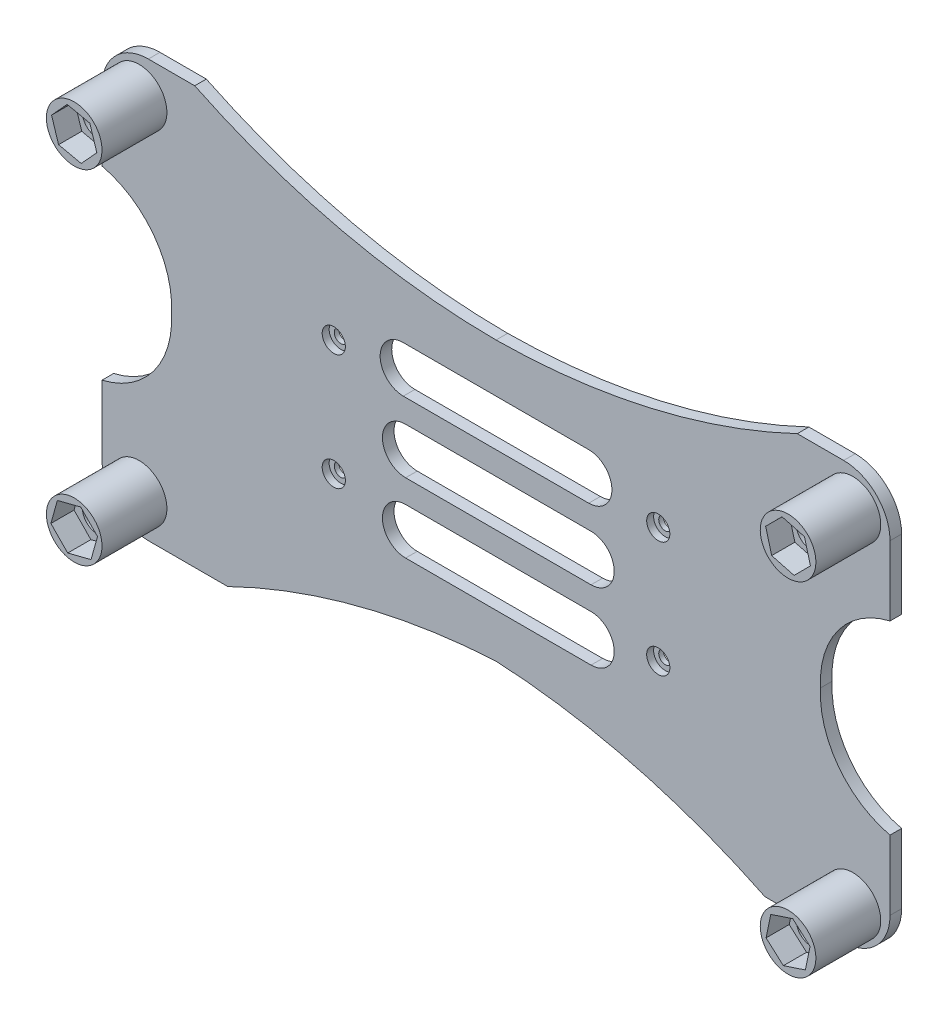
from build123d import *

# Parameters (mm, degrees)
EXTRUDE_1_DEPTH          = 2.5
CUT_EXTRUDE_1_DEPTH      = 42
CUT_EXTRUDE_1_DEPTH_BACK = 10
SKETCH_2_R               = 1.4
SKETCH_3_R               = 2.5
CUT_EXTRUDE_2_DEPTH      = 1.5
SKETCH_7_R               = 6
EXTRUDE_4_DEPTH          = 14
BUTTON_LEFT_NUT_DEPTH    = 5
UP_LEFT_NUT_DEPTH        = 5
UP_RIGHT_NUT_DEPTH       = 5
BUTTON_RIGHT_NUT_DEPTH   = 5
SKETCH_13_R              = 3.25
CUT_EXTRUDE_7_DEPTH      = 13
SKETCH_15_R              = 3.25
CUT_EXTRUDE_8_DEPTH      = 13
SKETCH_16_R              = 3.25
CUT_EXTRUDE_9_DEPTH      = 13
SKETCH_17_R              = 3.25
CUT_EXTRUDE_10_DEPTH     = 13


with BuildPart() as part:
    # 草图1 → 凸台-拉伸1 (new body)
    with BuildSketch(Plane.XY):
        with BuildLine():
            Line((-72.574116531, 45.487390308), (77.425883469, 45.487390308))
            ThreePointArc((77.425883469, 45.487390308), (84.496951281, 42.558458119), (87.425883469, 35.487390308))
            Line((87.425883469, 35.487390308), (87.425883469, -34.512609692))
            ThreePointArc((87.425883469, -34.512609692), (84.496951281, -41.583677504), (77.425883469, -44.512609692))
            Line((77.425883469, -44.512609692), (-72.574116531, -44.512609692))
            ThreePointArc((-72.574116531, -44.512609692), (-79.645184343, -41.583677504), (-82.574116531, -34.512609692))
            Line((-82.574116531, -34.512609692), (-82.574116531, 35.487390308))
            ThreePointArc((-82.574116531, 35.487390308), (-79.645184343, 42.558458119), (-72.574116531, 45.487390308))
        make_face()
    extrude(amount=EXTRUDE_1_DEPTH)

    # 草图2 → 切除-拉伸1 (cut, two sides: drawn at the far end of the back side and taken through both)
    with BuildSketch(Plane.XY.offset(2.5).offset(-CUT_EXTRUDE_1_DEPTH_BACK)):
        with Locations((-32.574116531, 12.987390308)):
            Circle(SKETCH_2_R)
        with Locations((-32.574116531, -12.012609692)):
            Circle(SKETCH_2_R)
        with Locations((37.425883469, 12.987390308)):
            Circle(SKETCH_2_R)
        with Locations((37.425883469, -12.012609692)):
            Circle(SKETCH_2_R)
        with BuildLine():
            Line((-55.457237, -44.512609692), (60.437772164, -44.512609692))
            ThreePointArc((60.437772164, -44.512609692), (32.18844776, -34.086412898), (2.425883469, -29.512609692))
            ThreePointArc((2.425883469, -29.512609692), (-27.27069034, -34.099106912), (-55.457237, -44.512609692))
        make_face()
        with BuildLine():
            Line((-62.574116531, 45.487390308), (67.425883469, 45.487390308))
            ThreePointArc((67.425883469, 45.487390308), (35.747267057, 34.428061428), (2.425883469, 30.487390308))
            ThreePointArc((2.425883469, 30.487390308), (-30.918540876, 34.328218147), (-62.574116531, 45.487390308))
        make_face()
        with BuildLine():
            Line((87.425883469, 20.487390308), (87.425883469, -19.512609692))
            ThreePointArc((87.425883469, -19.512609692), (76.286181126, -12.242386449), (72.425883469, 0.487390308))
            ThreePointArc((72.425883469, 0.487390308), (76.286181126, 13.217167065), (87.425883469, 20.487390308))
        make_face()
        with BuildLine():
            Line((-82.574116531, 20.487390308), (-82.574116531, -19.512609692))
            ThreePointArc((-82.574116531, -19.512609692), (-71.434414188, -12.242386449), (-67.574116531, 0.487390308))
            ThreePointArc((-67.574116531, 0.487390308), (-71.434414188, 13.217167065), (-82.574116531, 20.487390308))
        make_face()
        with BuildLine():
            Line((-17.574116531, 20), (22.425883469, 20))
            ThreePointArc((22.425883469, 20), (27.425883469, 15), (22.425883469, 10))
            Line((22.425883469, 10), (-17.574116531, 10))
            ThreePointArc((-17.574116531, 10), (-22.574116531, 15), (-17.574116531, 20))
        make_face()
        with BuildLine():
            Line((-17.079364826, 5), (22.920635174, 5))
            ThreePointArc((22.920635174, 5), (27.920635174, 0), (22.920635174, -5))
            Line((22.920635174, -5), (-17.079364826, -5))
            ThreePointArc((-17.079364826, -5), (-22.079364826, 0), (-17.079364826, 5))
        make_face()
        with BuildLine():
            Line((-17.079364826, -10), (22.920635174, -10))
            ThreePointArc((22.920635174, -10), (27.920635174, -15), (22.920635174, -20))
            Line((22.920635174, -20), (-17.079364826, -20))
            ThreePointArc((-17.079364826, -20), (-22.079364826, -15), (-17.079364826, -10))
        make_face()
    extrude(amount=CUT_EXTRUDE_1_DEPTH + CUT_EXTRUDE_1_DEPTH_BACK, mode=Mode.SUBTRACT)

    # 草图3 → 切除-拉伸2 (cut)
    with BuildSketch(Plane.XY.offset(2.5)):
        with Locations((-32.574116531, 12.987390308)):
            Circle(SKETCH_3_R)
        with Locations((37.425883469, 12.987390308)):
            Circle(SKETCH_3_R)
        with Locations((37.425883469, -12.012609692)):
            Circle(SKETCH_3_R)
        with Locations((-32.574116531, -12.012609692)):
            Circle(SKETCH_3_R)
    extrude(amount=-CUT_EXTRUDE_2_DEPTH, mode=Mode.SUBTRACT)

    # 草图7 → 凸台-拉伸4 (add)
    with BuildSketch(Plane.XY.offset(2.5)):
        with Locations((-74.574116531, 37.487390308)):
            Circle(SKETCH_7_R)
        with Locations((-74.574116531, -36.512609692)):
            Circle(SKETCH_7_R)
        with Locations((79.425883469, 37.487390308)):
            Circle(SKETCH_7_R)
        with Locations((79.425883469, -36.512609692)):
            Circle(SKETCH_7_R)
    extrude(amount=EXTRUDE_4_DEPTH)

    # 草图9 → button left nut (cut)
    with BuildSketch(Plane.XY.offset(16.5)):
        Polygon((-70.944636645, -40.226166125), (-69.543342379, -35.226166125), (-73.172822265, -31.512609692), (-78.203596417, -32.79905326), (-79.604890683, -37.79905326), (-75.975410797, -41.512609692), align=None)
    extrude(amount=-BUTTON_LEFT_NUT_DEPTH, mode=Mode.SUBTRACT)

    # 草图10 → up left nut (cut)
    with BuildSketch(Plane.XY.offset(16.5)):
        Polygon((-73.060671646, 32.721943363), (-69.690395974, 36.415348553), (-71.203840859, 41.180795498), (-76.087561416, 42.252837252), (-79.457837088, 38.559432062), (-77.944392202, 33.793985117), align=None)
    extrude(amount=-UP_LEFT_NUT_DEPTH, mode=Mode.SUBTRACT)

    # 草图11 → up right nut (cut)
    with BuildSketch(Plane.XY.offset(16.5)):
        Polygon((80.72901693, 32.660192033), (84.257926534, 36.202337852), (82.954793074, 41.029536126), (78.122750008, 42.314588582), (74.593840404, 38.772442763), (75.896973864, 33.945244489), align=None)
    extrude(amount=-UP_RIGHT_NUT_DEPTH, mode=Mode.SUBTRACT)

    # 草图12 → button right nut (cut)
    with BuildSketch(Plane.XY.offset(16.5)):
        Polygon((83.162930062, -39.834428887), (84.171186575, -34.937142005), (80.434139981, -31.61532281), (75.688836876, -33.190790498), (74.680580363, -38.08807738), (78.417626957, -41.409896575), align=None)
    extrude(amount=-BUTTON_RIGHT_NUT_DEPTH, mode=Mode.SUBTRACT)

    # 草图13 → 切除-拉伸7 (cut)
    with BuildSketch(Plane.XY.offset(16.5)):
        with Locations((-74.574116531, -36.512609692)):
            Circle(SKETCH_13_R)
    extrude(amount=-CUT_EXTRUDE_7_DEPTH, mode=Mode.SUBTRACT)

    # 草图15 → 切除-拉伸8 (cut)
    with BuildSketch(Plane.XY.offset(16.5)):
        with Locations((-74.574116531, 37.487390308)):
            Circle(SKETCH_15_R)
    extrude(amount=-CUT_EXTRUDE_8_DEPTH, mode=Mode.SUBTRACT)

    # 草图16 → 切除-拉伸9 (cut)
    with BuildSketch(Plane.XY.offset(16.5)):
        with Locations((79.425883469, 37.487390308)):
            Circle(SKETCH_16_R)
    extrude(amount=-CUT_EXTRUDE_9_DEPTH, mode=Mode.SUBTRACT)

    # 草图17 → 切除-拉伸10 (cut)
    with BuildSketch(Plane.XY.offset(16.5)):
        with Locations((79.425883469, -36.512609692)):
            Circle(SKETCH_17_R)
    extrude(amount=-CUT_EXTRUDE_10_DEPTH, mode=Mode.SUBTRACT)


solid = part.part
